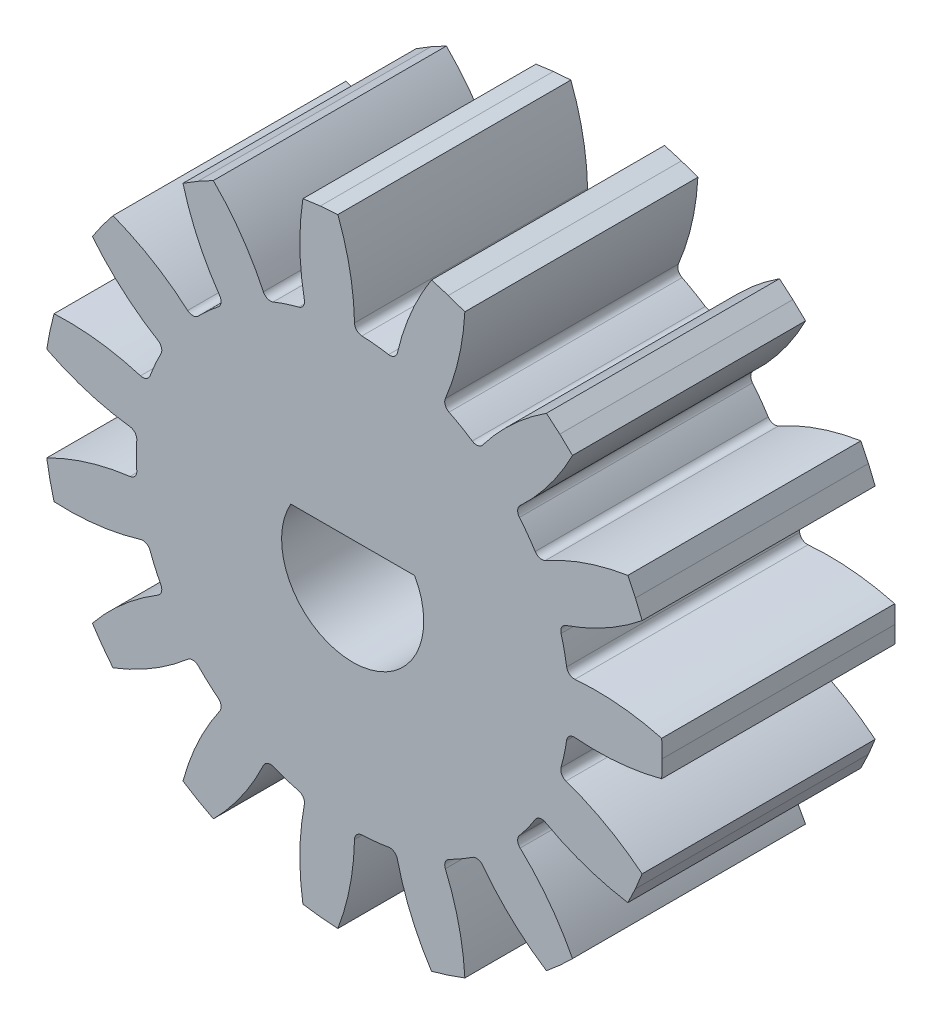
from build123d import *

# Parameters (mm, degrees)
BOSS_EXTRUDE1_DEPTH      = 10
FILLET1_R                = 0.3325
CIRPATTERN1_COUNT        = 15
FILLET1_OF_CIRPATTERN1_R = 0.3325
CUT_EXTRUDE1_REACH       = 23.269


with BuildPart() as part:
    # Sketch1 → Boss-Extrude1 (new body)
    with BuildSketch(Plane.XY):
        with BuildLine():
            Line((13.259889375, 0.752951085), (13.28125, 0))
            Line((13.28125, 0), (13.259889375, -0.752951085))
            ThreePointArc((13.259889375, -0.752951085), (11.25470075, -1.091188935), (9.221588785, -1.050667328))
            ThreePointArc((9.221588785, -1.050667328), (9.160560027, -1.491891937), (9.078432419, -1.92968038))
            Line((9.078432419, -1.92968038), (0, 0))
            Line((0, 0), (9.078432419, 1.92968038))
            ThreePointArc((9.078432419, 1.92968038), (9.160560027, 1.491891937), (9.221588785, 1.050667328))
            ThreePointArc((9.221588785, 1.050667328), (11.25470075, 1.091188935), (13.259889375, 0.752951085))
        make_face()
    boss_extrude1 = extrude(amount=BOSS_EXTRUDE1_DEPTH)

    # Fillet1
    fillet1_edges = [part.edges().sort_by_distance(p)[0] for p in [
        (9.221588785, 1.050667328, 5),
        (9.221588785, -1.050667328, 5),
    ]]
    fillet(fillet1_edges, radius=FILLET1_R)

    # CirPattern1: Boss-Extrude1 ×15 about axis
    cirpattern1_axis = Axis((0, 0, 10), (0, 0, -1))
    for i in range(1, CIRPATTERN1_COUNT):
        add(boss_extrude1.rotate(cirpattern1_axis, i * 360 / CIRPATTERN1_COUNT))

    # Fillet1 of CirPattern1
    fillet1_of_cirpattern1_edges = [part.edges().sort_by_distance(p)[0] for p in [
        (8.851685449, -2.790925702, 5),
        (7.996995645, -4.710590431, 5),
        (6.951245284, -6.149942323, 5),
        (5.389649308, -7.556009655, 5),
        (3.848871658, -8.445578045, 5),
        (1.850383641, -9.094926165, 5),
        (0.080993158, -9.280896598, 5),
        (-2.008830167, -9.061247316, 5),
        (-3.700889796, -8.511463815, 5),
        (-5.52069899, -7.460796488, 5),
        (-6.842855282, -6.270321614, 5),
        (-8.077988803, -4.570306167, 5),
        (-8.801628925, -2.944983842, 5),
        (-9.238520966, -0.889568391, 5),
        (-9.238520966, 0.889568391, 5),
        (-8.801628925, 2.944983842, 5),
        (-8.077988803, 4.570306167, 5),
        (-6.842855282, 6.270321614, 5),
        (-5.52069899, 7.460796488, 5),
        (-3.700889796, 8.511463815, 5),
        (-2.008830167, 9.061247316, 5),
        (0.080993158, 9.280896598, 5),
        (1.850383641, 9.094926165, 5),
        (3.848871658, 8.445578045, 5),
        (5.389649308, 7.556009655, 5),
        (6.951245284, 6.149942323, 5),
        (7.996995645, 4.710590431, 5),
        (8.851685449, 2.790925702, 5),
    ]]
    fillet(fillet1_of_cirpattern1_edges, radius=FILLET1_OF_CIRPATTERN1_R)

    # Sketch2 → Cut-Extrude1 (cut, up to next)
    with BuildSketch(Plane(origin=(0, 0, 0), x_dir=(-1, 0, 0), z_dir=(0, 0, -1)), mode=Mode.PRIVATE) as cut_extrude1_sk1:
        with BuildLine():
            Line((-2.655654345, 1.5), (2.655654345, 1.5))
            ThreePointArc((2.655654345, 1.5), (0, -3.05), (-2.655654345, 1.5))
        make_face()
    cut_extrude1_tool1 = extrude(cut_extrude1_sk1.sketch, amount=-CUT_EXTRUDE1_REACH, mode=Mode.PRIVATE) & part.part
    add(cut_extrude1_tool1.solids().sort_by_distance((0, -0.534074, 0))[0], mode=Mode.SUBTRACT)


solid = part.part
